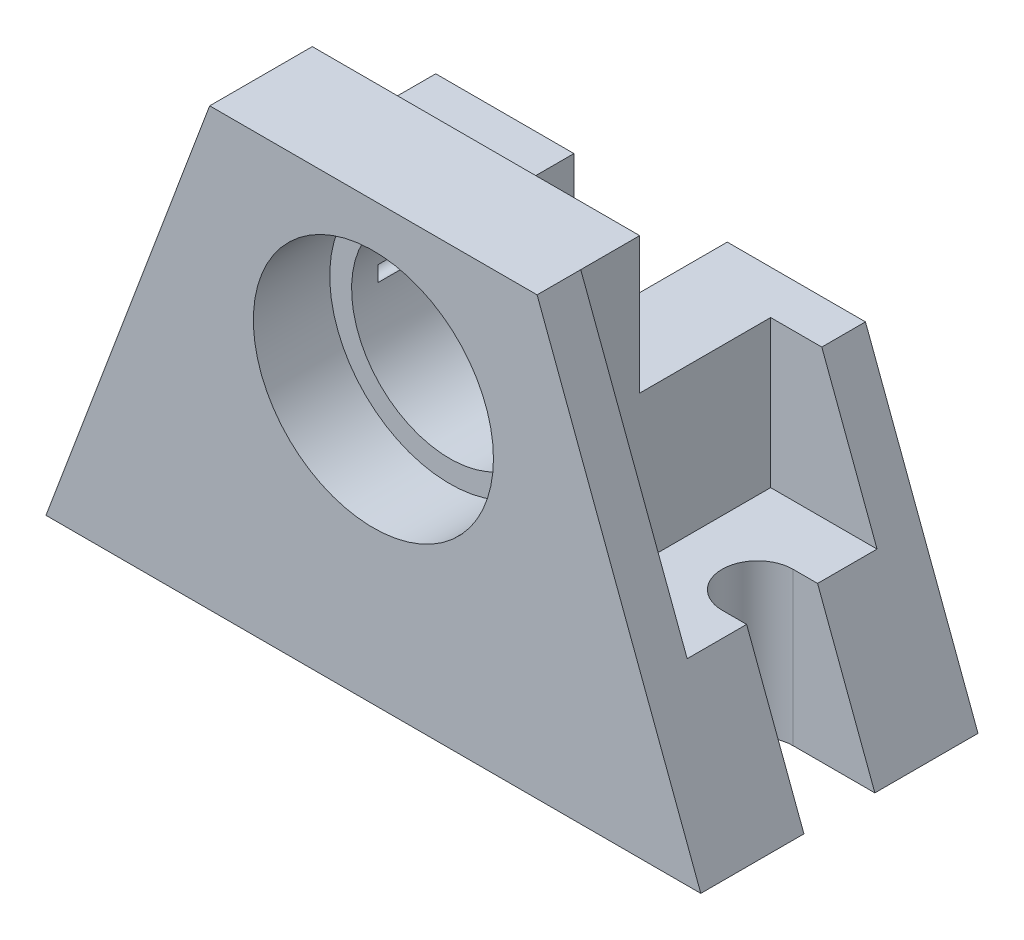
from build123d import *

# Parameters (mm, degrees)
SKETCH3_R              = 9
BOSS_EXTRUDE3_DEPTH    = 25.4
CUT_EXTRUDE2_START     = -26
CUT_EXTRUDE2_OUTLINE_W = 15
CUT_EXTRUDE2_OUTLINE_H = 17.4
CUT_EXTRUDE2_DEPTH     = 26
SKETCH5_W              = 5
SKETCH5_H              = 27.5
BOSS_EXTRUDE4_DEPTH    = 10
SKETCH6_W              = 60
SKETCH6_H              = 12.5
CUT_EXTRUDE3_DEPTH     = 16
SKETCH7_W              = 25
SKETCH7_H              = 6.5
BOSS_EXTRUDE5_DEPTH    = 4
CUT_EXTRUDE4_DEPTH     = 57.081726079
SKETCH9_R              = 11
CUT_EXTRUDE5_DEPTH     = 7
CUT_EXTRUDE6_START     = -16
SKETCH5_3_R            = 0.9
CUT_EXTRUDE6_DEPTH     = 16


# Read off the part's stored shape, not the designer's step: Cut-Extrude2
with BuildPart() as part:
    # Sketch3 → Boss-Extrude3 (new body)
    with BuildSketch(Plane.XY):
        Polygon((-30, -25), (30, -25), (15, 15), (-15, 15), align=None)
        Circle(SKETCH3_R, mode=Mode.SUBTRACT)
    extrude(amount=BOSS_EXTRUDE3_DEPTH)

    # Cut-Extrude2 outline → Cut-Extrude2 (cut)
    with BuildSketch(Plane(origin=(0, 15, 0), x_dir=(1, 0, 0), z_dir=(0, 1, 0)).offset(CUT_EXTRUDE2_START)):
        with Locations((22.5, -12.7)):
            Rectangle(CUT_EXTRUDE2_OUTLINE_W, CUT_EXTRUDE2_OUTLINE_H)
        with Locations((-22.5, -12.7)):
            Rectangle(CUT_EXTRUDE2_OUTLINE_W, CUT_EXTRUDE2_OUTLINE_H)
    extrude(amount=CUT_EXTRUDE2_DEPTH, mode=Mode.SUBTRACT)

    # Sketch5 → Boss-Extrude4 (add)
    with BuildSketch(Plane(origin=(0, 0, 0), x_dir=(-1, 0, 0), z_dir=(0, 0, -1))):
        with Locations((-9.525, -11.25)):
            Rectangle(SKETCH5_W, SKETCH5_H)
        with Locations((9.525, -11.25)):
            Rectangle(SKETCH5_W, SKETCH5_H)
    extrude(amount=-BOSS_EXTRUDE4_DEPTH)

    # Sketch6 → Cut-Extrude3 (cut)
    with BuildSketch(Plane(origin=(0, 0, 0), x_dir=(-1, 0, 0), z_dir=(0, 0, -1))):
        with Locations((0, 8.75)):
            Rectangle(SKETCH6_W, SKETCH6_H)
    extrude(amount=-CUT_EXTRUDE3_DEPTH, mode=Mode.SUBTRACT)

    # Sketch7 → Boss-Extrude5 (add)
    with BuildSketch(Plane.XZ.offset(25)):
        with Locations((0, 12.7)):
            Rectangle(SKETCH7_W, SKETCH7_H)
    extrude(amount=BOSS_EXTRUDE5_DEPTH)

    # Sketch8 → Cut-Extrude4 (cut, through all)
    with BuildSketch(Plane.XZ.offset(25)):
        with BuildLine():
            Line((37.5, 9.45), (22.5, 9.45))
            ThreePointArc((22.5, 9.45), (19.25, 12.7), (22.5, 15.95))
            Line((22.5, 15.95), (37.5, 15.95))
            ThreePointArc((37.5, 15.95), (40.75, 12.7), (37.5, 9.45))
        make_face()
        with BuildLine():
            Line((-37.5, 15.95), (-22.5, 15.95))
            ThreePointArc((-22.5, 15.95), (-19.25, 12.7), (-22.5, 9.45))
            Line((-22.5, 9.45), (-37.5, 9.45))
            ThreePointArc((-37.5, 9.45), (-40.75, 12.7), (-37.5, 15.95))
        make_face()
    extrude(amount=-CUT_EXTRUDE4_DEPTH, mode=Mode.SUBTRACT)

    # Sketch9 → Cut-Extrude5 (cut)
    with BuildSketch(Plane.XY.offset(25.4)):
        Circle(SKETCH9_R)
    extrude(amount=-CUT_EXTRUDE5_DEPTH, mode=Mode.SUBTRACT)

    # Sketch5<3> → Cut-Extrude6 (cut)
    with BuildSketch(Plane(origin=(0, 0, 0), x_dir=(-1, 0, 0), z_dir=(0, 0, -1)).offset(CUT_EXTRUDE6_START)):
        with Locations((9.525, 0)):
            Circle(SKETCH5_3_R)
        with Locations((-9.525, 0)):
            Circle(SKETCH5_3_R)
    extrude(amount=CUT_EXTRUDE6_DEPTH, mode=Mode.SUBTRACT)


solid = part.part
